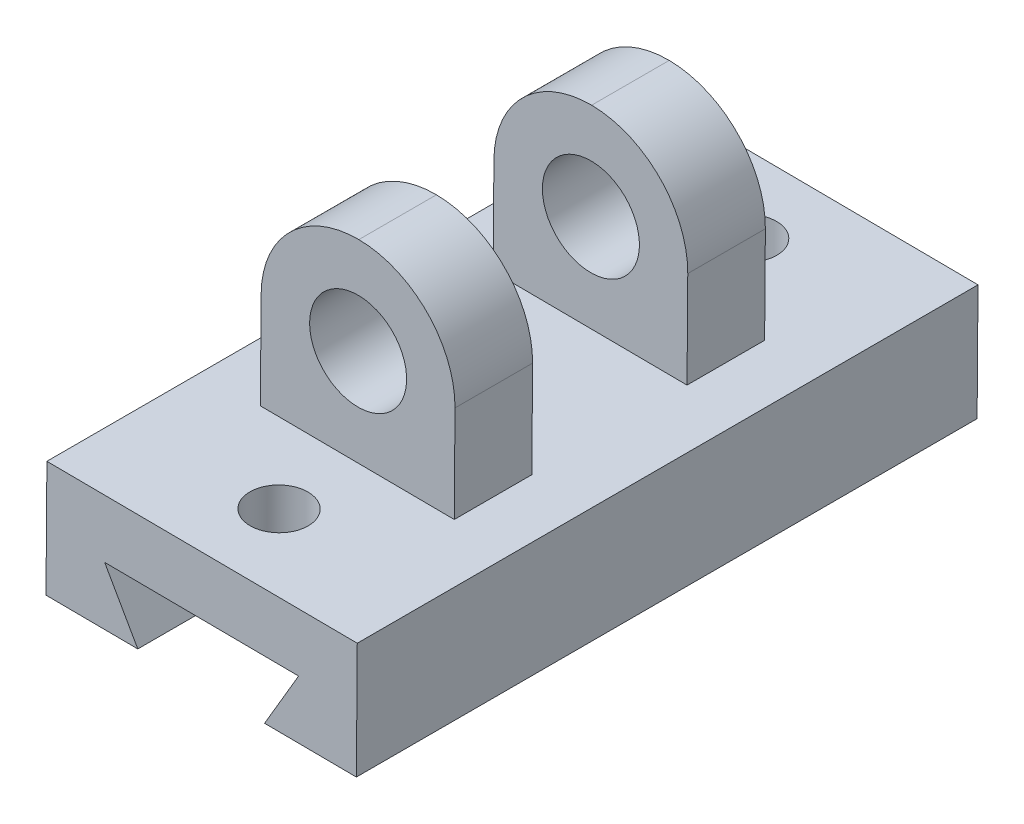
from build123d import *

# Parameters (mm, degrees)
BOSS_EXTRUDE2_DEPTH = 160
SKETCH10_R          = 7.5
CUT_EXTRUDE3_DEPTH  = 37
SKETCH15_W          = 49.972994953
SKETCH15_H          = 20
BOSS_EXTRUDE3_DEPTH = 50
FILLET8_R           = 25
FILLET9_R           = 25
FILLET10_R          = 25
FILLET11_R          = 25
SKETCH20_R          = 12.5
CUT_EXTRUDE16_DEPTH = 120


with BuildPart() as part:
    # Sketch9 → Boss-Extrude2 (new body)
    with BuildSketch(Plane.XY):
        Polygon((-46.127266272, 8.011064826), (33.872733728, 7.400024977), (33.643600468, -22.599099976), (9.984036558, -22.418388271), (18.758604622, -7.484970869), (-31.242270425, -7.10306428), (-22.696835622, -22.168771831), (-46.356399532, -21.988060127), align=None)
    extrude(amount=-BOSS_EXTRUDE2_DEPTH)

    # Sketch10 → Cut-Extrude3 (cut)
    with BuildSketch(Plane(origin=(0.058494066, 7.658298076, 0), x_dir=(0.9999708317686696, -0.007637775322375965, 0), z_dir=(0.007637775322375965, 0.9999708317686696, 0))):
        with Locations(Location((-5.952514862, 19.602368066, 0), (0, 0, 180))):
            Circle(SKETCH10_R)
        with Locations(Location((-5.952514862, 140.397631934, 0), (0, 0, 180))):
            Circle(SKETCH10_R)
    extrude(amount=-CUT_EXTRUDE3_DEPTH, mode=Mode.SUBTRACT)

    # Sketch15 → Boss-Extrude3 (add)
    with BuildSketch(Plane(origin=(0.058494066, 7.658298076, 0), x_dir=(0.9999708317686696, -0.007637775322375965, 0), z_dir=(0.007637775322375965, 0.9999708317686696, 0))):
        with Locations((-6.171271485, 50)):
            Rectangle(SKETCH15_W, SKETCH15_H)
        with Locations((-6.171271485, 110)):
            Rectangle(SKETCH15_W, SKETCH15_H)
    extrude(amount=BOSS_EXTRUDE3_DEPTH)

    # Fillet8
    fillet8_edges = [part.edges().sort_by_distance(p)[0] for p in [
        (-30.716477311, 57.894815703, -50),
    ]]
    fillet(fillet8_edges, radius=FILLET8_R)

    # Fillet9
    # the kernel refuses this fillet: 25 mm, written as the material it takes off along each edge
    with BuildSketch(Plane(origin=(19.255060017, 57.513133196, -122.5), x_dir=(-0.9999708317686696, 0.007637775322376116, 0), z_dir=(0, 0, 1))) as fillet9_piece_1_section:
        with BuildLine():
            CenterArc((FILLET9_R, FILLET9_R), FILLET9_R, 180, 90)
            Line((0, FILLET9_R), (0, 0))
            Line((0, 0), (FILLET9_R, 0))
        make_face()
    fillet9_piece_1 = extrude(amount=145, mode=Mode.PRIVATE)
    fillet9_piece_1 = split(fillet9_piece_1, bisect_by=Plane(origin=(11.883432775, 50.243784792, -100), z_dir=(0, 0, 1)), keep=Keep.TOP, mode=Mode.PRIVATE)
    add(fillet9_piece_1, mode=Mode.SUBTRACT)

    # Fillet10
    fillet10_edges = [part.edges().sort_by_distance(p)[0] for p in [
        (-30.716477311, 57.894815703, -110),
    ]]
    fillet(fillet10_edges, radius=FILLET10_R)

    # Fillet11
    # the kernel refuses this fillet: 25 mm, written as the material it takes off along each edge
    with BuildSketch(Plane(origin=(19.255060017, 57.513133196, -37.5), x_dir=(-0.9999708317686696, 0.007637775322376116, 0), z_dir=(0, 0, -1))) as fillet11_piece_1:
        with BuildLine():
            CenterArc((FILLET11_R, -FILLET11_R), FILLET11_R, 90, 90)
            Line((0, -FILLET11_R), (0, 0))
            Line((0, 0), (FILLET11_R, 0))
        make_face()
    extrude(amount=145, mode=Mode.SUBTRACT)

    # Sketch20 → Cut-Extrude16 (cut)
    with BuildSketch(Plane(origin=(0, 0, -120), x_dir=(-1, 0, 0), z_dir=(0, 0, -1))):
        with Locations((5.9081509, 32.704600526)):
            Circle(SKETCH20_R)
    extrude(amount=-CUT_EXTRUDE16_DEPTH, mode=Mode.SUBTRACT)


solid = part.part
